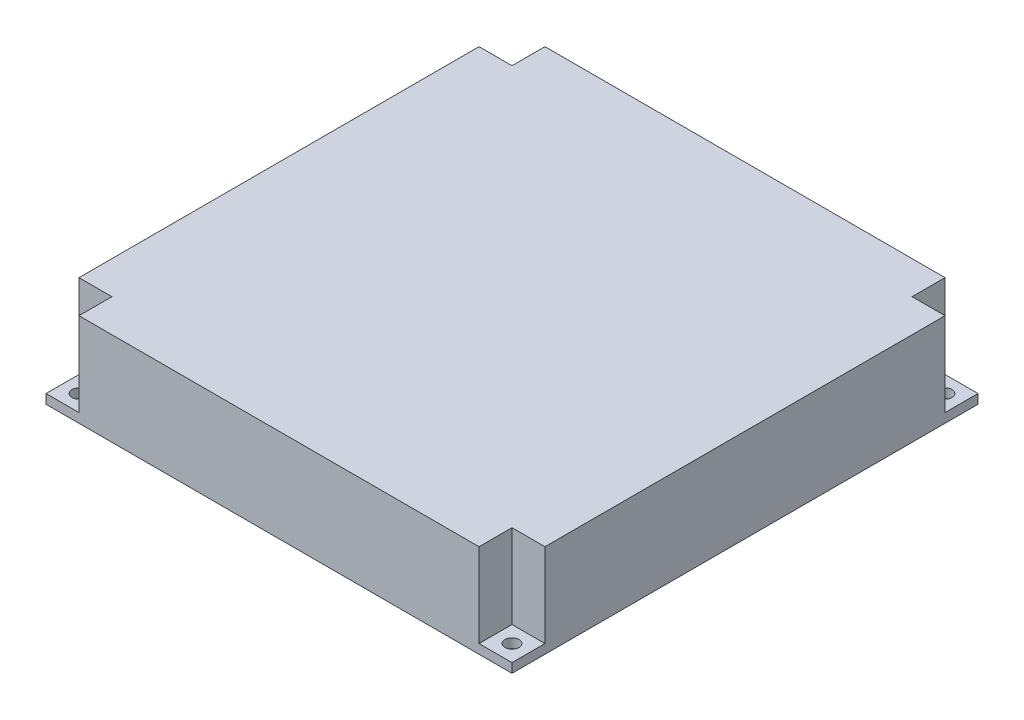
from build123d import *

# Parameters (mm, degrees)
CROQUIS1_W              = 100
CROQUIS1_H              = 100
SALIENTE_EXTRUIR1_DEPTH = 20
CROQUIS2_R              = 1.5
CORTAR_EXTRUIR1_DEPTH   = 28
CROQUIS3_W              = 7.071067812
CROQUIS3_H              = 7.071067812
CORTAR_EXTRUIR2_DEPTH   = 18
VACIADO1_START          = -48
VACIADO1_OUTLINE_W      = 18
VACIADO1_OUTLINE_H      = 81.857864376
VACIADO1_DEPTH          = 96
VACIADO1_START_2        = -40.928932188
VACIADO1_2_OUTLINE_W    = 18
VACIADO1_2_OUTLINE_H    = 7.071067812
VACIADO1_2_DEPTH        = 81.857864376


# Read off the part's stored shape, not the designer's step: Vaciado1
with BuildPart() as part:
    # Croquis1 → Saliente-Extruir1 (new body)
    with BuildSketch(Plane(origin=(0, 0, 0), x_dir=(1, 0, 0), z_dir=(0, 1, 0))):
        Rectangle(CROQUIS1_W, CROQUIS1_H)
    extrude(amount=SALIENTE_EXTRUIR1_DEPTH)

    # Croquis2 → Cortar-Extruir1 (cut)
    with BuildSketch(Plane(origin=(0, 20, 0), x_dir=(1, 0, 0), z_dir=(0, 1, 0))):
        with Locations(Location((-46.464466094, -46.464466094, 0), (0, 0, 270))):
            Circle(CROQUIS2_R)
        with Locations(Location((-46.464466094, 46.464466094, 0), (0, 0, 270))):
            Circle(CROQUIS2_R)
        with Locations(Location((46.464466094, 46.464466094, 0), (0, 0, 270))):
            Circle(CROQUIS2_R)
        with Locations(Location((46.464466094, -46.464466094, 0), (0, 0, 270))):
            Circle(CROQUIS2_R)
    extrude(amount=-CORTAR_EXTRUIR1_DEPTH, mode=Mode.SUBTRACT)

    # Croquis3 → Cortar-Extruir2 (cut)
    with BuildSketch(Plane(origin=(0, 20, 0), x_dir=(1, 0, 0), z_dir=(0, 1, 0))):
        with Locations((-46.464466094, -46.464466094)):
            Rectangle(CROQUIS3_W, CROQUIS3_H)
        with Locations((-46.464466094, 46.464466094)):
            Rectangle(CROQUIS3_W, CROQUIS3_H)
        with Locations((46.464466094, 46.464466094)):
            Rectangle(CROQUIS3_W, CROQUIS3_H)
        with Locations((46.464466094, -46.464466094)):
            Rectangle(CROQUIS3_W, CROQUIS3_H)
    extrude(amount=-CORTAR_EXTRUIR2_DEPTH, mode=Mode.SUBTRACT)

    # Vaciado1 outline → Vaciado1 (cut)
    with BuildSketch(Plane.YZ.offset(VACIADO1_START)):
        with Locations((9, 0)):
            Rectangle(VACIADO1_OUTLINE_W, VACIADO1_OUTLINE_H)
    extrude(amount=VACIADO1_DEPTH, mode=Mode.SUBTRACT)

    # Vaciado1 2 outline → Vaciado1 2 (cut)
    with BuildSketch(Plane.YZ.offset(VACIADO1_START_2)):
        with Locations((9, -44.464466094)):
            Rectangle(VACIADO1_2_OUTLINE_W, VACIADO1_2_OUTLINE_H)
        with Locations((9, 44.464466094)):
            Rectangle(VACIADO1_2_OUTLINE_W, VACIADO1_2_OUTLINE_H)
    extrude(amount=VACIADO1_2_DEPTH, mode=Mode.SUBTRACT)


solid = part.part
